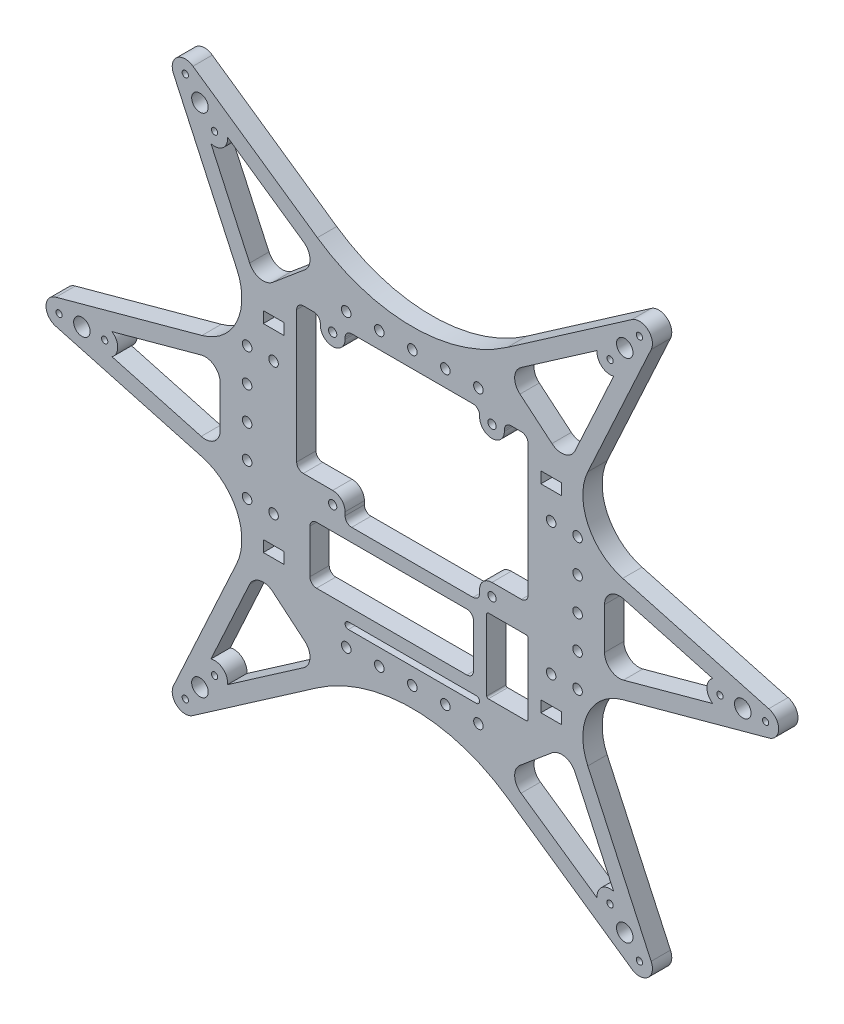
from build123d import *

# Parameters (mm, degrees)
SKETCH1_R             = 0.95
SKETCH1_R_2           = 1.45
SKETCH1_R_3           = 2.5
SKETCH1_R_4           = 1.449999999
SKETCH1_W             = 70
SKETCH1_H             = 78
SKETCH1_W_2           = 6.2
SKETCH1_H_2           = 3.4
BOSS_EXTRUDE1_DEPTH   = 5.85
SKETCH2_R             = 1.25
BOSS_EXTRUDE3_DEPTH   = 5.85
BOSS_EXTRUDE3_2_DEPTH = 5.85
SKETCH2_W             = 49.5
SKETCH2_H             = 17.27
BOSS_EXTRUDE3_3_DEPTH = 5.85
FILLET2_R             = 2
FILLET3_R             = 2
FILLET4_R             = 0.5
FILLET5_R             = 1
FILLET6_R             = 2


with BuildPart() as part:
    # Sketch1 → Boss-Extrude1 (new body)
    with BuildSketch(Plane.XY):
        with BuildLine():
            Line((587.176754813, 489.096238418), (568.014947547, 530.703594601))
            ThreePointArc((568.014947547, 530.703594601), (569.023643468, 535.466212845), (573.889065048, 535.63256443))
            Line((573.889065048, 535.63256443), (611.536899087, 509.536826494))
            ThreePointArc((611.536899087, 509.536826494), (640.276650002, 500.550186325), (669.016400917, 509.536826494))
            Line((669.016400917, 509.536826494), (706.664234956, 535.63256443))
            ThreePointArc((706.664234956, 535.63256443), (711.529656536, 535.466212845), (712.538352458, 530.703594601))
            Line((712.538352458, 530.703594601), (693.376545192, 489.096238418))
            ThreePointArc((693.376545192, 489.096238418), (693.409240928, 475.326320371), (703.936593716, 466.450141278))
            Line((703.936593716, 466.450141278), (748.126650002, 454.384244227))
            ThreePointArc((748.126650002, 454.384244227), (751.126650002, 450.550186325), (748.126650002, 446.716128422))
            Line((748.126650002, 446.716128422), (703.936593716, 434.650231372))
            ThreePointArc((703.936593716, 434.650231372), (693.409240928, 425.774052279), (693.376545192, 412.004134232))
            Line((693.376545192, 412.004134232), (712.538352458, 370.396778049))
            ThreePointArc((712.538352458, 370.396778049), (711.529656536, 365.634159805), (706.664234956, 365.46780822))
            Line((706.664234956, 365.46780822), (669.016400917, 391.563546156))
            ThreePointArc((669.016400917, 391.563546156), (640.276650002, 400.550186325), (611.536899087, 391.563546156))
            Line((611.536899087, 391.563546156), (573.889065048, 365.46780822))
            ThreePointArc((573.889065048, 365.46780822), (569.023643468, 365.634159805), (568.014947547, 370.396778049))
            Line((568.014947547, 370.396778049), (587.176754813, 412.004134232))
            ThreePointArc((587.176754813, 412.004134232), (587.144059076, 425.774052279), (576.616706289, 434.650231372))
            Line((576.616706289, 434.650231372), (532.426650002, 446.716128422))
            ThreePointArc((532.426650002, 446.716128422), (529.426650002, 450.550186325), (532.426650002, 454.384244227))
            Line((532.426650002, 454.384244227), (576.616706289, 466.450141278))
            ThreePointArc((576.616706289, 466.450141278), (587.144059076, 475.326320371), (587.176754813, 489.096238418))
        make_face()
        with Locations((533.376650002, 450.550186325)):
            Circle(SKETCH1_R, mode=Mode.SUBTRACT)
        with Locations(Location((598.276650002, 430.550186325, 0), (0, 0, 180))):
            Circle(SKETCH1_R_2, mode=Mode.SUBTRACT)
        with Locations((575.997889034, 527.154630637)):
            Circle(SKETCH1_R_3, mode=Mode.SUBTRACT)
        with Locations((547.176650002, 450.550186325)):
            Circle(SKETCH1_R, mode=Mode.SUBTRACT)
        with Locations((540.276650002, 450.550186325)):
            Circle(SKETCH1_R_3, mode=Mode.SUBTRACT)
        with Locations((590.276650002, 460.550186325)):
            Circle(SKETCH1_R_4, mode=Mode.SUBTRACT)
        with Locations((571.562654527, 532.440337294)):
            Circle(SKETCH1_R, mode=Mode.SUBTRACT)
        with Locations((580.43312354, 521.868923979)):
            Circle(SKETCH1_R, mode=Mode.SUBTRACT)
        with Locations((690.276650002, 440.550186325)):
            Circle(SKETCH1_R_4, mode=Mode.SUBTRACT)
        with Locations(Location((682.276650002, 470.550186325, 0), (0, 0, 180))):
            Circle(SKETCH1_R_2, mode=Mode.SUBTRACT)
        with Locations(Location((640.276650002, 406.550186325, 0), (0, 0, 180))):
            Circle(SKETCH1_R_2, mode=Mode.SUBTRACT)
        with Locations((690.276650002, 430.550186325)):
            Circle(SKETCH1_R_4, mode=Mode.SUBTRACT)
        with Locations((704.555410971, 373.945742013)):
            Circle(SKETCH1_R_3, mode=Mode.SUBTRACT)
        with Locations((708.990645478, 368.660035356)):
            Circle(SKETCH1_R, mode=Mode.SUBTRACT)
        with Locations((700.120176464, 379.231448671)):
            Circle(SKETCH1_R, mode=Mode.SUBTRACT)
        with Locations((630.276650002, 494.550186325)):
            Circle(SKETCH1_R_2, mode=Mode.SUBTRACT)
        with Locations((620.276650002, 494.550186325)):
            Circle(SKETCH1_R_2, mode=Mode.SUBTRACT)
        with Locations((650.276650002, 406.550186325)):
            Circle(SKETCH1_R_2, mode=Mode.SUBTRACT)
        with Locations((660.276650002, 406.550186325)):
            Circle(SKETCH1_R_2, mode=Mode.SUBTRACT)
        with Locations(Location((590.276650002, 430.550186325, 0), (0, 0, 180))):
            Circle(SKETCH1_R_4, mode=Mode.SUBTRACT)
        with Locations(Location((620.276650002, 406.550186325, 0), (0, 0, 180))):
            Circle(SKETCH1_R_2, mode=Mode.SUBTRACT)
        with Locations(Location((630.276650002, 406.550186325, 0), (0, 0, 180))):
            Circle(SKETCH1_R_2, mode=Mode.SUBTRACT)
        with Locations((682.276650002, 430.550186325)):
            Circle(SKETCH1_R_2, mode=Mode.SUBTRACT)
        with Locations((590.276650002, 470.550186325)):
            Circle(SKETCH1_R_4, mode=Mode.SUBTRACT)
        with Locations(Location((580.43312354, 379.231448671, 0), (0, 0, 180))):
            Circle(SKETCH1_R, mode=Mode.SUBTRACT)
        with Locations(Location((571.562654527, 368.660035356, 0), (0, 0, 180))):
            Circle(SKETCH1_R, mode=Mode.SUBTRACT)
        with Locations(Location((590.276650002, 440.550186325, 0), (0, 0, 180))):
            Circle(SKETCH1_R_4, mode=Mode.SUBTRACT)
        with Locations(Location((575.997889034, 373.945742013, 0), (0, 0, 180))):
            Circle(SKETCH1_R_3, mode=Mode.SUBTRACT)
        with Locations(Location((660.276650002, 494.550186325, 0), (0, 0, 180))):
            Circle(SKETCH1_R_2, mode=Mode.SUBTRACT)
        with Locations(Location((650.276650002, 494.550186325, 0), (0, 0, 180))):
            Circle(SKETCH1_R_2, mode=Mode.SUBTRACT)
        with Locations(Location((700.120176464, 521.868923979, 0), (0, 0, 180))):
            Circle(SKETCH1_R, mode=Mode.SUBTRACT)
        with Locations(Location((708.990645478, 532.440337294, 0), (0, 0, 180))):
            Circle(SKETCH1_R, mode=Mode.SUBTRACT)
        with Locations(Location((690.276650002, 450.550186325, 0), (0, 0, 180))):
            Circle(SKETCH1_R_4, mode=Mode.SUBTRACT)
        with Locations(Location((740.276650002, 450.550186325, 0), (0, 0, 180))):
            Circle(SKETCH1_R_3, mode=Mode.SUBTRACT)
        with Locations(Location((733.376650002, 450.550186325, 0), (0, 0, 180))):
            Circle(SKETCH1_R, mode=Mode.SUBTRACT)
        with Locations(Location((704.555410971, 527.154630637, 0), (0, 0, 180))):
            Circle(SKETCH1_R_3, mode=Mode.SUBTRACT)
        with Locations(Location((747.176650002, 450.550186325, 0), (0, 0, 180))):
            Circle(SKETCH1_R, mode=Mode.SUBTRACT)
        with Locations(Location((690.276650002, 470.550186325, 0), (0, 0, 180))):
            Circle(SKETCH1_R_4, mode=Mode.SUBTRACT)
        with Locations((640.276650002, 494.550186325)):
            Circle(SKETCH1_R_2, mode=Mode.SUBTRACT)
        with Locations(Location((690.276650002, 460.550186325, 0), (0, 0, 180))):
            Circle(SKETCH1_R_4, mode=Mode.SUBTRACT)
        with Locations((590.276650002, 450.550186325)):
            Circle(SKETCH1_R_4, mode=Mode.SUBTRACT)
        with Locations((598.276650002, 470.550186325)):
            Circle(SKETCH1_R_2, mode=Mode.SUBTRACT)
        with BuildLine():
            Line((549.378217697, 453.82975942), (576.389421361, 461.205047663))
            ThreePointArc((576.389421361, 461.205047663), (580.337323048, 460.434368256), (582.12067631, 456.828882764))
            Line((582.12067631, 456.828882764), (582.12067631, 444.271489885))
            ThreePointArc((582.12067631, 444.271489885), (580.337323048, 440.666004394), (576.389421361, 439.895324987))
            Line((576.389421361, 439.895324987), (549.378217697, 447.27061323))
            ThreePointArc((549.378217697, 447.27061323), (551.126650002, 450.550186325), (549.378217697, 453.82975942))
        make_face(mode=Mode.SUBTRACT)
        with Locations((640.276650002, 450.550186325)):
            Rectangle(SKETCH1_W, SKETCH1_H, mode=Mode.SUBTRACT)
        with Locations((598.276650002, 420.550186325)):
            Rectangle(SKETCH1_W_2, SKETCH1_H_2, mode=Mode.SUBTRACT)
        with BuildLine():
            Line((731.175082307, 447.27061323), (704.163878644, 439.895324987))
            ThreePointArc((704.163878644, 439.895324987), (700.215976956, 440.666004394), (698.432623695, 444.271489885))
            Line((698.432623695, 444.271489885), (698.432623695, 456.828882764))
            ThreePointArc((698.432623695, 456.828882764), (700.215976956, 460.434368256), (704.163878644, 461.205047663))
            Line((704.163878644, 461.205047663), (731.175082307, 453.82975942))
            ThreePointArc((731.175082307, 453.82975942), (729.426650002, 450.550186325), (731.175082307, 447.27061323))
        make_face(mode=Mode.SUBTRACT)
        with Locations((682.276650002, 420.550186325)):
            Rectangle(SKETCH1_W_2, SKETCH1_H_2, mode=Mode.SUBTRACT)
        with BuildLine():
            Line((701.217334773, 383.02601632), (689.50466631, 408.458542689))
            ThreePointArc((689.50466631, 408.458542689), (686.402651889, 410.966389543), (682.526885868, 410.022871097))
            Line((682.526885868, 410.022871097), (672.851587783, 401.904332043))
            ThreePointArc((672.851587783, 401.904332043), (671.249383797, 398.251287875), (673.18047167, 394.760916987))
            Line((673.18047167, 394.760916987), (696.192737283, 378.809878419))
            ThreePointArc((696.192737283, 378.809878419), (697.581165406, 382.257324221), (701.217334773, 383.02601632))
        make_face(mode=Mode.SUBTRACT)
        with BuildLine():
            Line((607.701712221, 401.904332043), (598.026414137, 410.022871097))
            ThreePointArc((598.026414137, 410.022871097), (594.150648115, 410.966389543), (591.048633694, 408.458542689))
            Line((591.048633694, 408.458542689), (579.335965232, 383.02601632))
            ThreePointArc((579.335965232, 383.02601632), (582.972134599, 382.257324221), (584.360562722, 378.809878419))
            Line((584.360562722, 378.809878419), (607.372828334, 394.760916987))
            ThreePointArc((607.372828334, 394.760916987), (609.303916208, 398.251287875), (607.701712221, 401.904332043))
        make_face(mode=Mode.SUBTRACT)
        with BuildLine():
            Line((579.335965232, 518.07435633), (591.048633694, 492.641829961))
            ThreePointArc((591.048633694, 492.641829961), (594.150648115, 490.133983107), (598.026414137, 491.077501553))
            Line((598.026414137, 491.077501553), (607.701712221, 499.196040607))
            ThreePointArc((607.701712221, 499.196040607), (609.303916208, 502.849084775), (607.372828334, 506.339455663))
            Line((607.372828334, 506.339455663), (584.360562722, 522.29049423))
            ThreePointArc((584.360562722, 522.29049423), (582.972134599, 518.843048429), (579.335965232, 518.07435633))
        make_face(mode=Mode.SUBTRACT)
        with Locations((682.276650002, 480.550186325)):
            Rectangle(SKETCH1_W_2, SKETCH1_H_2, mode=Mode.SUBTRACT)
        with BuildLine():
            Line((672.851587783, 499.196040607), (682.526885868, 491.077501553))
            ThreePointArc((682.526885868, 491.077501553), (686.402651889, 490.133983107), (689.50466631, 492.641829961))
            Line((689.50466631, 492.641829961), (701.217334773, 518.07435633))
            ThreePointArc((701.217334773, 518.07435633), (697.581165406, 518.843048429), (696.192737283, 522.29049423))
            Line((696.192737283, 522.29049423), (673.18047167, 506.339455663))
            ThreePointArc((673.18047167, 506.339455663), (671.249383797, 502.849084775), (672.851587783, 499.196040607))
        make_face(mode=Mode.SUBTRACT)
        with Locations((598.276650002, 480.550186325)):
            Rectangle(SKETCH1_W_2, SKETCH1_H_2, mode=Mode.SUBTRACT)
    extrude(amount=BOSS_EXTRUDE1_DEPTH)


with BuildPart() as body_2:
    # Sketch2 → Boss-Extrude3 (new body)
    with BuildSketch(Plane.XY.offset(5.85)):
        with BuildLine():
            Line((619.921650002, 487.080186325), (619.921650002, 489.550186325))
            Line((619.921650002, 489.550186325), (612.421650002, 489.550186325))
            Line((612.421650002, 489.550186325), (612.421650002, 487.080186325))
            ThreePointArc((612.421650002, 487.080186325), (616.171650002, 483.330186325), (619.921650002, 487.080186325))
        make_face()
        with Locations((616.171650002, 487.080186325)):
            Circle(SKETCH2_R, mode=Mode.SUBTRACT)
    extrude(amount=-BOSS_EXTRUDE3_DEPTH)


with BuildPart() as body_3:
    # Sketch2 → Boss-Extrude3 2 (new body)
    with BuildSketch(Plane.XY.offset(5.85)):
        with BuildLine():
            Line((668.131650002, 487.080186325), (668.131650002, 489.550186325))
            Line((668.131650002, 489.550186325), (660.631650002, 489.550186325))
            Line((660.631650002, 489.550186325), (660.631650002, 487.080186325))
            ThreePointArc((660.631650002, 487.080186325), (664.381650002, 483.330186325), (668.131650002, 487.080186325))
        make_face()
        with Locations((664.381650002, 487.080186325)):
            Circle(SKETCH2_R, mode=Mode.SUBTRACT)
    extrude(amount=-BOSS_EXTRUDE3_2_DEPTH)


with BuildPart() as body_4:
    # Sketch2 → Boss-Extrude3 3 (new body)
    with BuildSketch(Plane.XY.offset(5.85)):
        with BuildLine():
            Line((675.276650002, 437.050186325), (675.276650002, 445.620186325))
            Line((675.276650002, 445.620186325), (664.381650002, 445.620186325))
            ThreePointArc((664.381650002, 445.620186325), (661.729999573, 444.521836754), (660.631650002, 441.870186325))
            Line((660.631650002, 441.870186325), (660.631650002, 438.820186325))
            Line((660.631650002, 438.820186325), (619.921650002, 438.820186325))
            Line((619.921650002, 438.820186325), (619.921650002, 441.870186325))
            ThreePointArc((619.921650002, 441.870186325), (618.823300432, 444.521836754), (616.171650002, 445.620186325))
            Line((616.171650002, 445.620186325), (605.276650002, 445.620186325))
            Line((605.276650002, 445.620186325), (605.276650002, 411.550186325))
            Line((605.276650002, 411.550186325), (619.921650002, 411.550186325))
            Line((619.921650002, 411.550186325), (619.921650002, 413.550186325))
            Line((619.921650002, 413.550186325), (660.631650002, 413.550186325))
            Line((660.631650002, 413.550186325), (660.631650002, 411.550186325))
            Line((660.631650002, 411.550186325), (675.276650002, 411.550186325))
            Line((675.276650002, 411.550186325), (675.276650002, 414.550186325))
            Line((675.276650002, 414.550186325), (662.776650002, 414.550186325))
            Line((662.776650002, 414.550186325), (662.776650002, 437.050186325))
            Line((662.776650002, 437.050186325), (675.276650002, 437.050186325))
        make_face()
        with Locations((634.026650002, 426.185186325)):
            Rectangle(SKETCH2_W, SKETCH2_H, mode=Mode.SUBTRACT)
        with Locations((616.171650002, 441.870186325)):
            Circle(SKETCH2_R, mode=Mode.SUBTRACT)
        with Locations((664.381650002, 441.870186325)):
            Circle(SKETCH2_R, mode=Mode.SUBTRACT)
    extrude(amount=-BOSS_EXTRUDE3_3_DEPTH)


with BuildPart() as body_2_1:
    add(body_2.part)

    # Combine1: union body 3, body 4, part
    add(body_3.part)
    add(body_4.part)
    add(part.part)

    # Fillet2
    fillet2_edges = [body_2_1.edges().sort_by_distance(p)[0] for p in [
        (619.921650002, 438.820186325, 2.925),
    ]]
    fillet(fillet2_edges, radius=FILLET2_R)

    # Fillet3
    fillet3_edges = [body_2_1.edges().sort_by_distance(p)[0] for p in [
        (612.421650002, 489.550186325, 2.925),
        (619.921650002, 489.550186325, 2.925),
        (668.131650002, 489.550186325, 2.925),
        (660.631650002, 489.550186325, 2.925),
        (660.631650002, 438.820186325, 2.925),
        (609.276650002, 434.820186325, 2.925),
        (658.776650002, 434.820186325, 2.925),
        (658.776650002, 417.550186325, 2.925),
        (609.276650002, 417.550186325, 2.925),
    ]]
    fillet(fillet3_edges, radius=FILLET3_R)

    # Fillet4
    fillet4_edges = [body_2_1.edges().sort_by_distance(p)[0] for p in [
        (662.776650002, 414.550186325, 2.925),
        (662.776650002, 437.050186325, 2.925),
        (675.276650002, 437.050186325, 2.925),
        (675.276650002, 414.550186325, 2.925),
    ]]
    fillet(fillet4_edges, radius=FILLET4_R)

    # Fillet5
    fillet5_edges = [body_2_1.edges().sort_by_distance(p)[0] for p in [
        (660.631650002, 411.550186325, 2.925),
        (660.631650002, 413.550186325, 2.925),
        (619.921650002, 411.550186325, 2.925),
        (619.921650002, 413.550186325, 2.925),
    ]]
    fillet(fillet5_edges, radius=FILLET5_R - 0.0001)  # a hair under: the kernel refuses the full size

    # Fillet6
    fillet6_edges = [body_2_1.edges().sort_by_distance(p)[0] for p in [
        (605.276650002, 489.550186325, 2.925),
        (605.276650002, 445.620186325, 2.925),
        (675.276650002, 445.620186325, 2.925),
        (675.276650002, 489.550186325, 2.925),
    ]]
    fillet(fillet6_edges, radius=FILLET6_R)


solid = body_2_1.part
